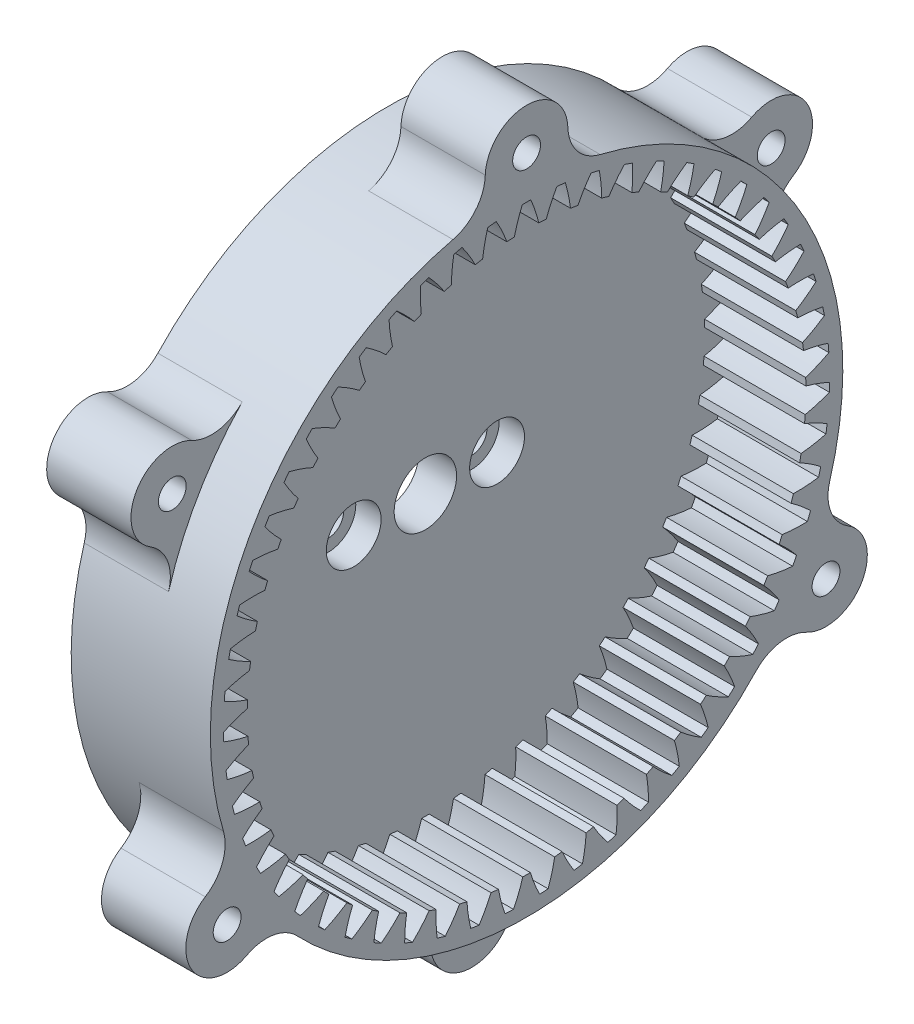
from build123d import *

# Parameters (mm, degrees)
BASPROSKE_W         = 12
BASPROSKE_H         = 4.375
TOOTHCUT_DEPTH      = 55.373706881
TEETHCUTS_COUNT     = 55
TEETHCUTS_ANGLE     = 353.454545455
SKETCH2_R           = 37.5
BOSS_EXTRUDE2_DEPTH = 4.5
SKETCH3_R           = 3.7
SKETCH3_R_2         = 1.8
CUT_EXTRUDE1_DEPTH  = 10
SKETCH4_R           = 3.25
CUT_EXTRUDE2_DEPTH  = 3
BOSS_EXTRUDE3_START = -10
SKETCH5_R           = 1.65
BOSS_EXTRUDE3_DEPTH = 10
FILLET1_R           = 5
SKETCH6_R           = 1.65
BOSS_EXTRUDE4_DEPTH = 10
FILLET2_R           = 5


with BuildPart() as part:
    # BasProSke → Base-Revolve (revolve)
    with BuildSketch(Plane(origin=(0, 0, 0), x_dir=(1, 0, 0), z_dir=(0, 1, 0)), mode=Mode.PRIVATE) as base_revolve_sk:
        with Locations((6, 35.3125)):
            Rectangle(BASPROSKE_W, BASPROSKE_H)
    revolve(base_revolve_sk.sketch.rotate(Axis((-10, 0, 0), (1, 0, 0)), 180), axis=Axis((-10, 0, 0), (1, 0, 0)))

    # TooCutSke → ToothCut (cut, through all)
    with BuildSketch(Plane(origin=(0, 0, 0), x_dir=(0, 0, -1), z_dir=(1, 0, 0))):
        with BuildLine():
            ThreePointArc((1.451447951, 33.067761022), (1.040603726, 34.522224287), (0.503573985, 35.934971761))
            ThreePointArc((0.503573985, 35.934971761), (0, 35.9385), (-0.503573985, 35.934971761))
            ThreePointArc((-0.503573985, 35.934971761), (-1.040603726, 34.522224287), (-1.451447951, 33.067761022))
            ThreePointArc((-1.451447951, 33.067761022), (0, 33.0996), (1.451447951, 33.067761022))
        make_face()
    toothcut = extrude(amount=TOOTHCUT_DEPTH, mode=Mode.SUBTRACT)

    # TeethCuts: ToothCut ×55 about axis
    teethcuts_axis = Axis((-10, 0, 0), (1, 0, 0))
    for i in range(1, TEETHCUTS_COUNT):
        add(toothcut.rotate(teethcuts_axis, i * TEETHCUTS_ANGLE / (TEETHCUTS_COUNT - 1)), mode=Mode.SUBTRACT)

    # Sketch2 → Boss-Extrude2 (add)
    with BuildSketch(Plane.ZY):
        Circle(SKETCH2_R)
    extrude(amount=BOSS_EXTRUDE2_DEPTH)

    # Sketch3 → Cut-Extrude1 (cut)
    with BuildSketch(Plane(origin=(0, 0, 0), x_dir=(0, 0, -1), z_dir=(1, 0, 0))):
        Circle(SKETCH3_R)
        with Locations((8.5, 0)):
            Circle(SKETCH3_R_2)
        with Locations((-8.5, 0)):
            Circle(SKETCH3_R_2)
    extrude(amount=-CUT_EXTRUDE1_DEPTH, mode=Mode.SUBTRACT)

    # Sketch4 → Cut-Extrude2 (cut)
    with BuildSketch(Plane(origin=(0, 0, 0), x_dir=(0, 0, -1), z_dir=(1, 0, 0))):
        with Locations((8.5, 0)):
            Circle(SKETCH4_R)
        with Locations((-8.5, 0)):
            Circle(SKETCH4_R)
    extrude(amount=-CUT_EXTRUDE2_DEPTH, mode=Mode.SUBTRACT)

    # Sketch5 → Boss-Extrude3 (add)
    # profile 1 of 3: a face of its own
    with BuildSketch(Plane.ZY.offset(4.5).offset(BOSS_EXTRUDE3_START)):
        with BuildLine():
            ThreePointArc((3.276511835, -37.356585366), (0, -45.9), (-3.276511835, -37.356585366))
            ThreePointArc((-3.276511835, -37.356585366), (0, -37.5), (3.276511835, -37.356585366))
        make_face()
        with Locations((0, -41)):
            Circle(SKETCH5_R, mode=Mode.SUBTRACT)
    # profile 2 of 3: a face of its own
    with BuildSketch(Plane.ZY.offset(4.5).offset(BOSS_EXTRUDE3_START)):
        with BuildLine():
            ThreePointArc((-33.990007843, 15.840750198), (-39.750566034, 22.95), (-30.713496008, 21.515835168))
            ThreePointArc((-30.713496008, 21.515835168), (-32.475952642, 18.75), (-33.990007843, 15.840750198))
        make_face()
        with Locations((-35.507041555, 20.5)):
            Circle(SKETCH5_R, mode=Mode.SUBTRACT)
    # profile 3 of 3: a face of its own
    with BuildSketch(Plane.ZY.offset(4.5).offset(BOSS_EXTRUDE3_START)):
        with BuildLine():
            ThreePointArc((30.713496008, 21.515835168), (39.750566034, 22.95), (33.990007843, 15.840750198))
            ThreePointArc((33.990007843, 15.840750198), (32.475952642, 18.75), (30.713496008, 21.515835168))
        make_face()
        with Locations((35.507041555, 20.5)):
            Circle(SKETCH5_R, mode=Mode.SUBTRACT)
    extrude(amount=BOSS_EXTRUDE3_DEPTH)

    # Fillet1
    fillet1_edges = [part.edges().sort_by_distance(p)[0] for p in [
        (0.5, -37.356585366, -3.276511835),
        (0.5, -37.356585366, 3.276511835),
        (0.5, 21.515835168, -30.713496008),
        (0.5, 15.840750198, -33.990007843),
        (0.5, 15.840750198, 33.990007843),
        (0.5, 21.515835168, 30.713496008),
    ]]
    fillet(fillet1_edges, radius=FILLET1_R)

    # Sketch6 → Boss-Extrude4 (add)
    # profile 1 of 3: a face of its own
    with BuildSketch(Plane(origin=(12, 0, 0), x_dir=(0, 0, -1), z_dir=(1, 0, 0))):
        with BuildLine():
            ThreePointArc((33.990007843, -15.840750198), (39.750566034, -22.95), (30.713496008, -21.515835168))
            ThreePointArc((30.713496008, -21.515835168), (32.475952642, -18.75), (33.990007843, -15.840750198))
        make_face()
        with Locations((35.507041555, -20.5)):
            Circle(SKETCH6_R, mode=Mode.SUBTRACT)
    # profile 2 of 3: a face of its own
    with BuildSketch(Plane(origin=(12, 0, 0), x_dir=(0, 0, -1), z_dir=(1, 0, 0))):
        with BuildLine():
            ThreePointArc((-30.713496008, -21.515835168), (-39.750566034, -22.95), (-33.990007843, -15.840750198))
            ThreePointArc((-33.990007843, -15.840750198), (-32.475952642, -18.75), (-30.713496008, -21.515835168))
        make_face()
        with Locations((-35.507041555, -20.5)):
            Circle(SKETCH6_R, mode=Mode.SUBTRACT)
    # profile 3 of 3: a face of its own
    with BuildSketch(Plane(origin=(12, 0, 0), x_dir=(0, 0, -1), z_dir=(1, 0, 0))):
        with BuildLine():
            ThreePointArc((-3.276511835, 37.356585366), (0, 45.9), (3.276511835, 37.356585366))
            ThreePointArc((3.276511835, 37.356585366), (0, 37.5), (-3.276511835, 37.356585366))
        make_face()
        with Locations((0, 41)):
            Circle(SKETCH6_R, mode=Mode.SUBTRACT)
    extrude(amount=-BOSS_EXTRUDE4_DEPTH)

    # Fillet2
    fillet2_edges = [part.edges().sort_by_distance(p)[0] for p in [
        (7, -21.515835168, -30.713496008),
        (7, -15.840750198, -33.990007843),
        (7, -15.840750198, 33.990007843),
        (7, -21.515835168, 30.713496008),
        (7, 37.356585366, -3.276511835),
        (7, 37.356585366, 3.276511835),
    ]]
    fillet(fillet2_edges, radius=FILLET2_R)


solid = part.part
